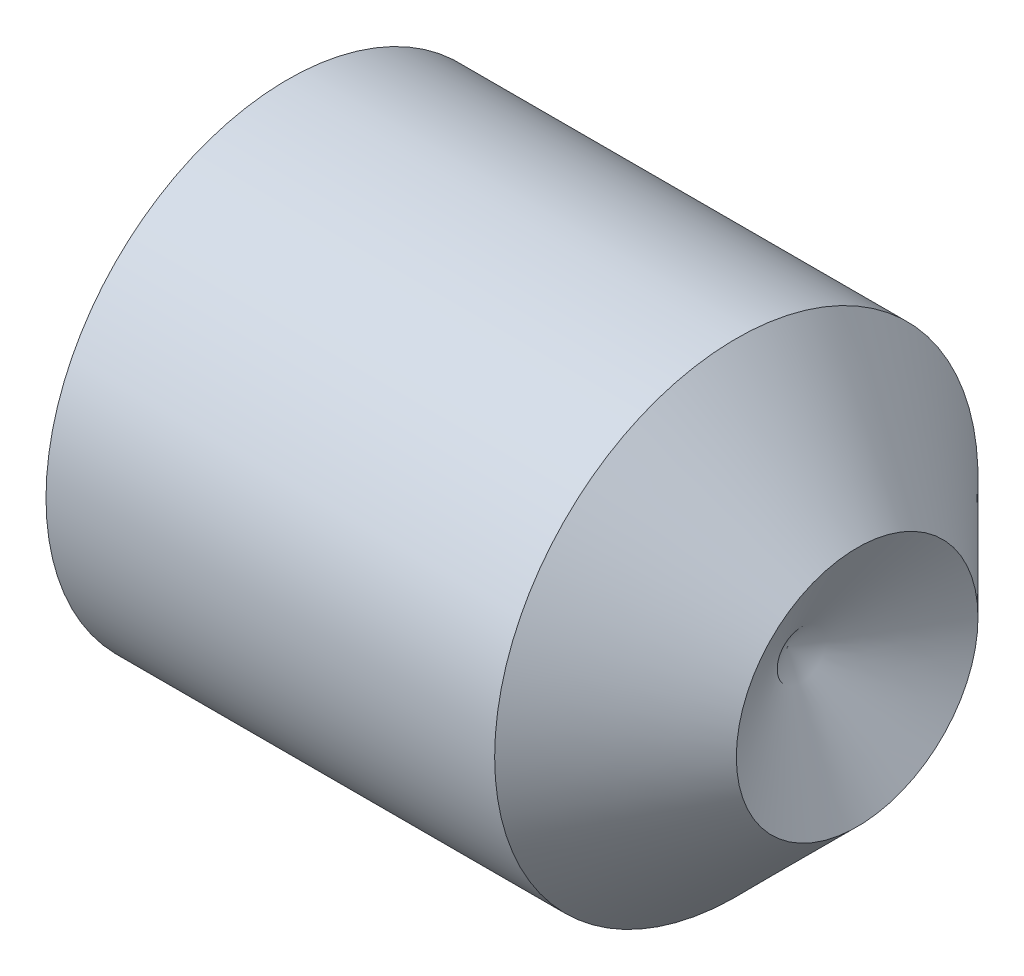
from build123d import *

# Parameters (mm, degrees)
HEXAGONSOCKET_DEPTH = 0.7


with BuildPart() as part:
    # BodySke → BaseBody (revolve)
    with BuildSketch(Plane.XY):
        Polygon((2, 0), (2, 0.4), (1.6, 0.8), (0, 0.8), (0, 0), align=None)
    revolve(axis=Axis((0, 0, 0), (1, 0, 0)))

    # HeadChamferSke → HeadChamfer (revolve, cut)
    with BuildSketch(Plane.XY):
        Polygon((0, 0.8), (0, 0.601), (0.114892704, 0.8), align=None)
    revolve(axis=Axis((0, 0, 0), (1, 0, 0)), mode=Mode.SUBTRACT)

    # HexagonSocketSke → HexagonSocket (cut)
    with BuildSketch(Plane.ZY):
        Polygon((0, 0.404145188), (-0.35, 0.202072594), (-0.35, -0.202072594), (0, -0.404145188), (0.35, -0.202072594), (0.35, 0.202072594), align=None)
    extrude(amount=-HEXAGONSOCKET_DEPTH, mode=Mode.SUBTRACT)

    # CupPointSke → CupPoint (revolve, cut)
    with BuildSketch(Plane.XY):
        Polygon((2, 0.4), (2, 0), (1.769059892, 0), align=None)
    revolve(axis=Axis((0, 0, 0), (1, 0, 0)), mode=Mode.SUBTRACT)


solid = part.part
